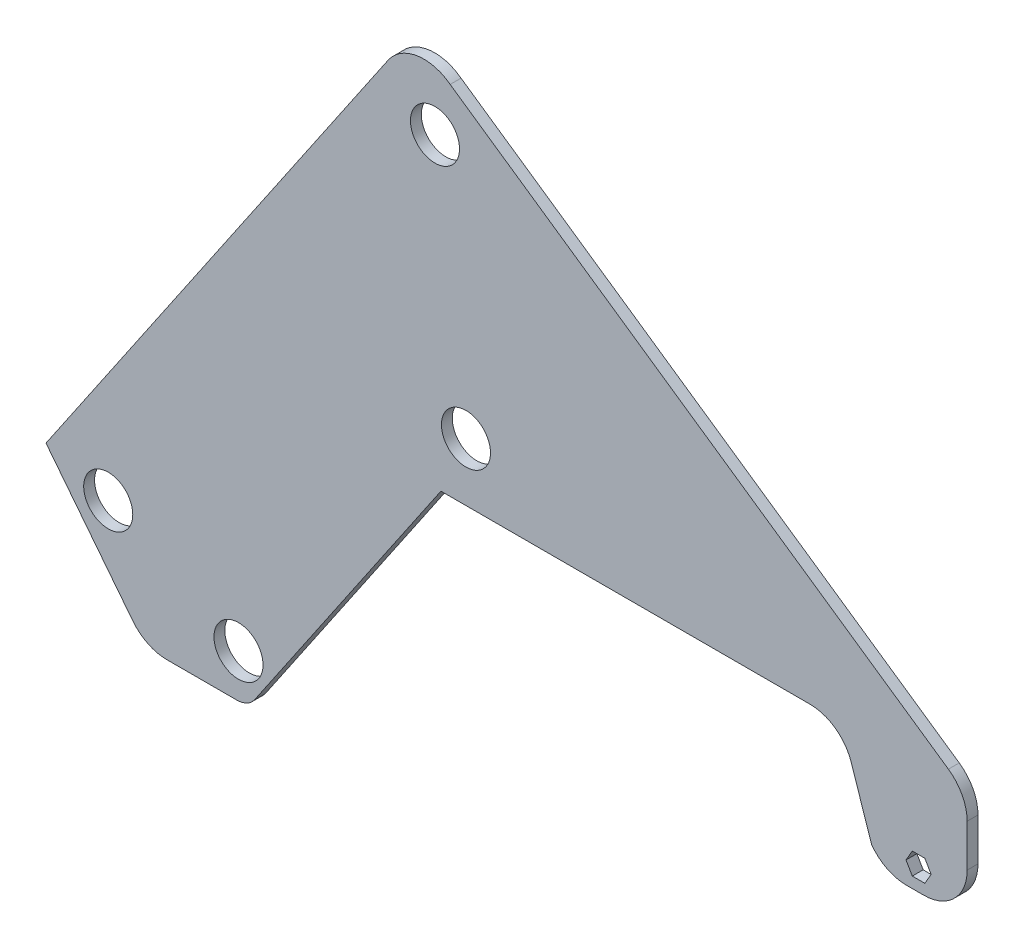
from build123d import *

# Parameters (mm, degrees)
MODEL_R             = 14.351
BOSS_EXTRUDE1_DEPTH = 6.35


with BuildPart() as part:
    # Model → Boss-Extrude1 (new body)
    with BuildSketch(Plane.XY):
        with BuildLine():
            Line((-314.23831963, -55.359484793), (-205.338802982, 104.650248016))
            Line((-205.338802982, 104.650248016), (-11.396613492, 104.650248016))
            Line((-11.396613492, 104.650248016), (-2.138802982, 104.650248016))
            Line((-2.138802982, 104.650248016), (10.561197018, 104.650248016))
            ThreePointArc((10.561197018, 104.650248016), (25.411048982, 99.857089032), (34.656357532, 87.286617831))
            Line((34.656357532, 87.286617831), (46.592108535, 51.500082009))
            ThreePointArc((46.592108535, 51.500082009), (55.588253468, 43.884919686), (67.053108098, 41.150248016))
            Line((67.053108098, 41.150248016), (77.072108535, 41.150248016))
            ThreePointArc((77.072108535, 41.150248016), (95.032620777, 48.589735774), (102.472108535, 66.550248016))
            Line((102.472108535, 66.550248016), (102.472108535, 83.872407327))
            Line((102.472108535, 83.872407327), (102.472108535, 91.319036973))
            ThreePointArc((102.472108535, 91.319036973), (99.562595882, 103.12318789), (91.500614136, 112.223061134))
            Line((91.500614136, 112.223061134), (-199.949582693, 313.389629113))
            ThreePointArc((-199.949582693, 313.389629113), (-219.402189514, 318.224062751), (-236.303247901, 307.447705012))
            Line((-236.303247901, 307.447705012), (-436.377385414, 13.472026599))
            Line((-436.377385414, 13.472026599), (-385.58146606, -51.20282143))
            ThreePointArc((-385.58146606, -51.20282143), (-376.71145599, -58.357541068), (-365.605974805, -60.913979882))
            Line((-365.605974805, -60.913979882), (-324.737451002, -60.913979882))
            ThreePointArc((-324.737451002, -60.913979882), (-318.798508014, -59.439796386), (-314.23831963, -55.359484793))
        make_face()
        with Locations((-323.775189267, -35.513979882)):
            Circle(MODEL_R, mode=Mode.SUBTRACT)
        with Locations((-399.975189267, 2.586020118)):
            Circle(MODEL_R, mode=Mode.SUBTRACT)
        Polygon((77.727371227, 60.200248016), (81.393545437, 53.850248016), (77.727371227, 47.500248016), (70.395022809, 47.500248016), (66.728848599, 53.850248016), (70.395022809, 60.200248016), align=None, mode=Mode.SUBTRACT)
        with Locations((-190.707148919, 138.516914683)):
            Circle(MODEL_R, mode=Mode.SUBTRACT)
        with Locations((-208.832932893, 283.437784316)):
            Circle(MODEL_R, mode=Mode.SUBTRACT)
    extrude(amount=BOSS_EXTRUDE1_DEPTH)


solid = part.part
